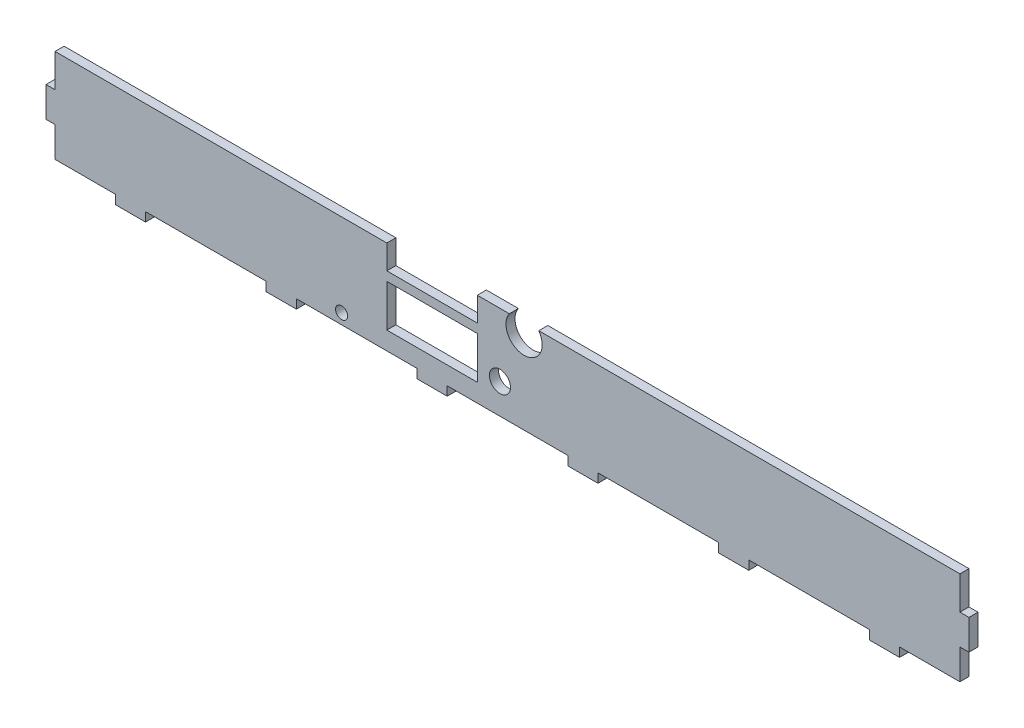
from build123d import *

# Parameters (mm, degrees)
IMPORTED_BODY_4_1_OUTLINE_W = 30
IMPORTED_BODY_4_1_OUTLINE_H = 14
IMPORTED_BODY_4_1_DEPTH     = 3
SKETCH_1_R                  = 3.5
SKETCH_1_R_2                = 2
SKETCH_1_R_3                = 6
CUT_EXTRUDE_1_DEPTH         = 3


# Read off the part's stored shape, not the designer's step: 基体零件-零件4-1
with BuildPart() as part:
    # 基体零件-零件4-1 outline → 基体零件-零件4-1 (new body)
    with BuildSketch(Plane.XY):
        Polygon((110, 31), (0, 31), (0, 20), (-3, 20), (-3, 10), (0, 10), (0, 0), (20, 0), (20, -3), (30, -3), (30, 0), (70, 0), (70, -3), (80, -3), (80, 0), (120, 0), (120, -3), (130, -3), (130, 0), (170, 0), (170, -3), (180, -3), (180, 0), (220, 0), (220, -3), (230, -3), (230, 0), (270, 0), (270, -3), (280, -3), (280, 0), (300, 0), (300, 10), (303, 10), (303, 20), (300, 20), (300, 31), (140, 31), (140, 23), (110, 23), align=None)
        with Locations((125, 13)):
            Rectangle(IMPORTED_BODY_4_1_OUTLINE_W, IMPORTED_BODY_4_1_OUTLINE_H, mode=Mode.SUBTRACT)
    extrude(amount=IMPORTED_BODY_4_1_DEPTH)

    # 草图1 → 切除-拉伸1 (cut)
    with BuildSketch(Plane(origin=(0, 0, 0), x_dir=(-1, 0, 0), z_dir=(0, 0, -1))):
        with Locations(Location((-147.5, 10, 0), (0, 0, 180))):
            Circle(SKETCH_1_R)
        with Locations(Location((-95, 3.5, 0), (0, 0, 180))):
            Circle(SKETCH_1_R_2)
        with Locations((-155.5, 27.5)):
            Circle(SKETCH_1_R_3)
    extrude(amount=-CUT_EXTRUDE_1_DEPTH, mode=Mode.SUBTRACT)


solid = part.part
